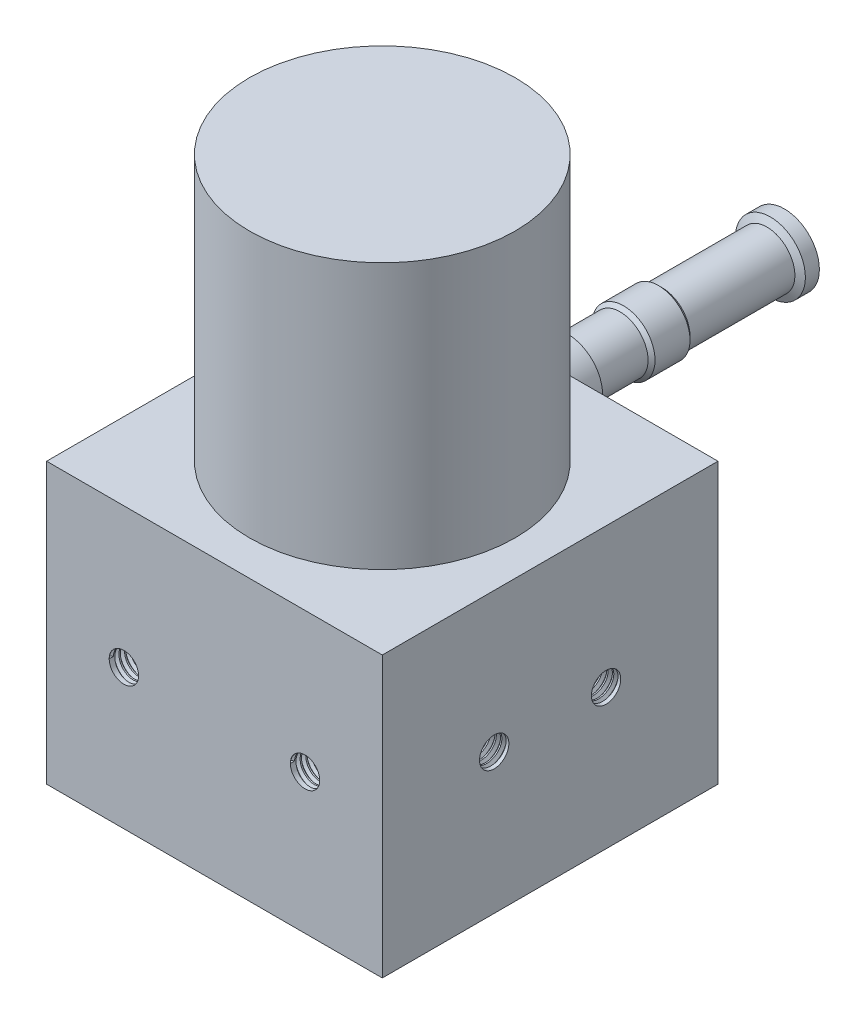
from build123d import *
from build123d.topology import SkipClean

# Parameters (mm, degrees)
SKETCH1_W           = 48
SKETCH1_H           = 48
BOSS_EXTRUDE1_DEPTH = 40
SKETCH2_R           = 19
BOSS_EXTRUDE2_DEPTH = 38
SKETCH4_R           = 5
BOSS_EXTRUDE3_DEPTH = 46
SKETCH5_W           = 31
SKETCH5_H           = 2
SKETCH6_R           = 2.1
CUT_EXTRUDE1_DEPTH  = 5
SKETCH8_R           = 2.1
CUT_EXTRUDE2_DEPTH  = 5
THREAD1_PITCH       = 0.8
THREAD2_PITCH       = 0.8
THREAD3_PITCH       = 0.8
THREAD4_PITCH       = 0.8


with BuildPart() as part:
    # Sketch1 → Boss-Extrude1 (new body)
    with BuildSketch(Plane(origin=(0, 0, 0), x_dir=(1, 0, 0), z_dir=(0, 1, 0))):
        Rectangle(SKETCH1_W, SKETCH1_H)
    extrude(amount=BOSS_EXTRUDE1_DEPTH)

    # Sketch2 → Boss-Extrude2 (add)
    with BuildSketch(Plane(origin=(0, 40, 0), x_dir=(1, 0, 0), z_dir=(0, 1, 0))):
        with Locations(Location((0, 0, 0), (0, 0, 270))):
            Circle(SKETCH2_R)
    extrude(amount=BOSS_EXTRUDE2_DEPTH)

    # Sketch4 → Boss-Extrude3 (add)
    with BuildSketch(Plane(origin=(0, 0, -24), x_dir=(-1, 0, 0), z_dir=(0, 0, -1))):
        with Locations(Location((12.5, 25, 0), (0, 0, 180))):
            Circle(SKETCH4_R)
    extrude(amount=BOSS_EXTRUDE3_DEPTH)

    # Sketch5 → Cut-Revolve1 (revolve, cut)
    with BuildSketch(Plane(origin=(-12.5, 0, 0), x_dir=(0, 0, -1), z_dir=(1, 0, 0)), mode=Mode.PRIVATE) as cut_revolve1_sk:
        Polygon((39, 30), (39, 29), (46.5, 29), (47, 29.5), (52, 29.5), (52.5, 29), (67.5, 29), (68, 30), align=None)
        with Locations((54.5, 26)):
            Rectangle(SKETCH5_W, SKETCH5_H)
    revolve(cut_revolve1_sk.sketch.rotate(Axis((-12.5, 25, -24), (0, 0, -1)), 90), axis=Axis((-12.5, 25, -24), (0, 0, -1)), mode=Mode.SUBTRACT)

    # Sketch6 → Cut-Extrude1 (cut)
    with BuildSketch(Plane.XY.offset(24)):
        with Locations((-12.954, 20)):
            Circle(SKETCH6_R)
        with Locations((12.954, 20)):
            Circle(SKETCH6_R)
    extrude(amount=-CUT_EXTRUDE1_DEPTH, mode=Mode.SUBTRACT)

    # Sketch8 → Cut-Extrude2 (cut)
    with BuildSketch(Plane(origin=(24, 0, 0), x_dir=(0, 0, -1), z_dir=(1, 0, 0))):
        with Locations((8, 20)):
            Circle(SKETCH8_R)
        with Locations((-8, 20)):
            Circle(SKETCH8_R)
    extrude(amount=-CUT_EXTRUDE2_DEPTH, mode=Mode.SUBTRACT)

    # Thread1: the profile of Thread Profile1 profile screwed along a right-hand helix of 6.25 turns, 8 arcs to a turn; built about Z, then put on its axis
    with SkipClean():  # the faces are left unmerged after this step: merging them gives an invalid solid
        thread1_z = Axis((0, 0, 0), (0, 0, 1))
        thread1_corners = [(2.0997, 0, -0.000173205), (2.5330127, 0, 0.249999999), (2.5330127, 0, 0.349999999), (2.0997, 0, 0.600173203)]
        with BuildLine(mode=Mode.PRIVATE) as thread1_profile:
            Line(thread1_corners[0], thread1_corners[1])
            Line(thread1_corners[1], thread1_corners[2])
            Line(thread1_corners[2], thread1_corners[3])
            Line(thread1_corners[3], thread1_corners[0])
        thread1_cap = Face(thread1_profile.wire())
        thread1_turn_angles = [0, 22.5, 45, 67.5, 90, 112.5, 135, 157.5, 180, 202.5, 225, 247.5, 270, 292.5, 315, 337.5, 360]
        thread1_turn_weights = [1, 0.9238795325112867, 1, 0.9238795325112867, 1, 0.9238795325112867, 1, 0.9238795325112867, 1, 0.9238795325112867, 1, 0.9238795325112867, 1, 0.9238795325112867, 1, 0.9238795325112867, 1]
        thread1_turn_rails = [Edge.make_bspline([Vector(p[0], p[1], 0).rotate(thread1_z, thread1_turn_angles[k]) / thread1_turn_weights[k] + Vector(0, 0, p[2] + THREAD1_PITCH * thread1_turn_angles[k] / 360) for k in range(17)], [0, 0, 0, 1, 1, 2, 2, 3, 3, 4, 4, 5, 5, 6, 6, 7, 7, 8, 8, 8], 2, thread1_turn_weights) for p in thread1_corners]
        thread1_turn_sides = [Face.make_surface_from_curves(thread1_turn_rails[p[0]], thread1_turn_rails[p[1]]) for p in [(0, 1), (1, 2), (2, 3), (3, 0)]]
        thread1_last_angles = [2160, 2182.5, 2205, 2227.5, 2250]
        thread1_last_weights = [1, 0.9238795325112867, 1, 0.9238795325112867, 1]
        thread1_last_rails = [Edge.make_bspline([Vector(p[0], p[1], 0).rotate(thread1_z, thread1_last_angles[k]) / thread1_last_weights[k] + Vector(0, 0, p[2] + THREAD1_PITCH * thread1_last_angles[k] / 360) for k in range(5)], [0, 0, 0, 1, 1, 2, 2, 2], 2, thread1_last_weights) for p in thread1_corners]
        thread1_last_sides = [Face.make_surface_from_curves(thread1_last_rails[p[0]], thread1_last_rails[p[1]]) for p in [(0, 1), (1, 2), (2, 3), (3, 0)]]
        thread1 = Plane(origin=(24, 20, 8), x_dir=(0, 0, 1), z_dir=(-1, 0, 0)) * Solid(Shell([*[p.moved(Location((0, 0, THREAD1_PITCH * i))) for i in range(6) for p in thread1_turn_sides], *thread1_last_sides, thread1_cap, thread1_cap.rotate(thread1_z, 2250).moved(Location((0, 0, THREAD1_PITCH * 2250 / 360)))]))
        add(thread1, mode=Mode.SUBTRACT)

    # Thread2: the profile of Thread Profile2 profile screwed along a right-hand helix of 6.25 turns, 8 arcs to a turn; built about Z, then put on its axis
    with SkipClean():  # the faces are left unmerged after this step: merging them gives an invalid solid
        thread2_z = Axis((0, 0, 0), (0, 0, 1))
        thread2_corners = [(2.0997, 0, -0.000173205), (2.5330127, 0, 0.249999999), (2.5330127, 0, 0.349999999), (2.0997, 0, 0.600173203)]
        with BuildLine(mode=Mode.PRIVATE) as thread2_profile:
            Line(thread2_corners[0], thread2_corners[1])
            Line(thread2_corners[1], thread2_corners[2])
            Line(thread2_corners[2], thread2_corners[3])
            Line(thread2_corners[3], thread2_corners[0])
        thread2_cap = Face(thread2_profile.wire())
        thread2_turn_angles = [0, 22.5, 45, 67.5, 90, 112.5, 135, 157.5, 180, 202.5, 225, 247.5, 270, 292.5, 315, 337.5, 360]
        thread2_turn_weights = [1, 0.9238795325112867, 1, 0.9238795325112867, 1, 0.9238795325112867, 1, 0.9238795325112867, 1, 0.9238795325112867, 1, 0.9238795325112867, 1, 0.9238795325112867, 1, 0.9238795325112867, 1]
        thread2_turn_rails = [Edge.make_bspline([Vector(p[0], p[1], 0).rotate(thread2_z, thread2_turn_angles[k]) / thread2_turn_weights[k] + Vector(0, 0, p[2] + THREAD2_PITCH * thread2_turn_angles[k] / 360) for k in range(17)], [0, 0, 0, 1, 1, 2, 2, 3, 3, 4, 4, 5, 5, 6, 6, 7, 7, 8, 8, 8], 2, thread2_turn_weights) for p in thread2_corners]
        thread2_turn_sides = [Face.make_surface_from_curves(thread2_turn_rails[p[0]], thread2_turn_rails[p[1]]) for p in [(0, 1), (1, 2), (2, 3), (3, 0)]]
        thread2_last_angles = [2160, 2182.5, 2205, 2227.5, 2250]
        thread2_last_weights = [1, 0.9238795325112867, 1, 0.9238795325112867, 1]
        thread2_last_rails = [Edge.make_bspline([Vector(p[0], p[1], 0).rotate(thread2_z, thread2_last_angles[k]) / thread2_last_weights[k] + Vector(0, 0, p[2] + THREAD2_PITCH * thread2_last_angles[k] / 360) for k in range(5)], [0, 0, 0, 1, 1, 2, 2, 2], 2, thread2_last_weights) for p in thread2_corners]
        thread2_last_sides = [Face.make_surface_from_curves(thread2_last_rails[p[0]], thread2_last_rails[p[1]]) for p in [(0, 1), (1, 2), (2, 3), (3, 0)]]
        thread2 = Plane(origin=(24, 20, -8), x_dir=(0, 0, 1), z_dir=(-1, 0, 0)) * Solid(Shell([*[p.moved(Location((0, 0, THREAD2_PITCH * i))) for i in range(6) for p in thread2_turn_sides], *thread2_last_sides, thread2_cap, thread2_cap.rotate(thread2_z, 2250).moved(Location((0, 0, THREAD2_PITCH * 2250 / 360)))]))
        add(thread2, mode=Mode.SUBTRACT)

    # Thread3: the profile of Thread Profile3 profile screwed along a right-hand helix of 6.25 turns, 8 arcs to a turn; built about Z, then put on its axis
    with SkipClean():  # the faces are left unmerged after this step: merging them gives an invalid solid
        thread3_z = Axis((0, 0, 0), (0, 0, 1))
        thread3_corners = [(2.0997, 0, -0.000173205), (2.5330127, 0, 0.249999999), (2.5330127, 0, 0.349999999), (2.0997, 0, 0.600173203)]
        with BuildLine(mode=Mode.PRIVATE) as thread3_profile:
            Line(thread3_corners[0], thread3_corners[1])
            Line(thread3_corners[1], thread3_corners[2])
            Line(thread3_corners[2], thread3_corners[3])
            Line(thread3_corners[3], thread3_corners[0])
        thread3_cap = Face(thread3_profile.wire())
        thread3_turn_angles = [0, 22.5, 45, 67.5, 90, 112.5, 135, 157.5, 180, 202.5, 225, 247.5, 270, 292.5, 315, 337.5, 360]
        thread3_turn_weights = [1, 0.9238795325112867, 1, 0.9238795325112867, 1, 0.9238795325112867, 1, 0.9238795325112867, 1, 0.9238795325112867, 1, 0.9238795325112867, 1, 0.9238795325112867, 1, 0.9238795325112867, 1]
        thread3_turn_rails = [Edge.make_bspline([Vector(p[0], p[1], 0).rotate(thread3_z, thread3_turn_angles[k]) / thread3_turn_weights[k] + Vector(0, 0, p[2] + THREAD3_PITCH * thread3_turn_angles[k] / 360) for k in range(17)], [0, 0, 0, 1, 1, 2, 2, 3, 3, 4, 4, 5, 5, 6, 6, 7, 7, 8, 8, 8], 2, thread3_turn_weights) for p in thread3_corners]
        thread3_turn_sides = [Face.make_surface_from_curves(thread3_turn_rails[p[0]], thread3_turn_rails[p[1]]) for p in [(0, 1), (1, 2), (2, 3), (3, 0)]]
        thread3_last_angles = [2160, 2182.5, 2205, 2227.5, 2250]
        thread3_last_weights = [1, 0.9238795325112867, 1, 0.9238795325112867, 1]
        thread3_last_rails = [Edge.make_bspline([Vector(p[0], p[1], 0).rotate(thread3_z, thread3_last_angles[k]) / thread3_last_weights[k] + Vector(0, 0, p[2] + THREAD3_PITCH * thread3_last_angles[k] / 360) for k in range(5)], [0, 0, 0, 1, 1, 2, 2, 2], 2, thread3_last_weights) for p in thread3_corners]
        thread3_last_sides = [Face.make_surface_from_curves(thread3_last_rails[p[0]], thread3_last_rails[p[1]]) for p in [(0, 1), (1, 2), (2, 3), (3, 0)]]
        thread3 = Plane(origin=(12.954, 20, 24), x_dir=(-1, 0, 0), z_dir=(0, 0, -1)) * Solid(Shell([*[p.moved(Location((0, 0, THREAD3_PITCH * i))) for i in range(6) for p in thread3_turn_sides], *thread3_last_sides, thread3_cap, thread3_cap.rotate(thread3_z, 2250).moved(Location((0, 0, THREAD3_PITCH * 2250 / 360)))]))
        add(thread3, mode=Mode.SUBTRACT)

    # Thread4: the profile of Thread Profile4 profile screwed along a right-hand helix of 6.25 turns, 8 arcs to a turn; built about Z, then put on its axis
    with SkipClean():  # the faces are left unmerged after this step: merging them gives an invalid solid
        thread4_z = Axis((0, 0, 0), (0, 0, 1))
        thread4_corners = [(2.0997, 0, -0.000173205), (2.5330127, 0, 0.249999999), (2.5330127, 0, 0.349999999), (2.0997, 0, 0.600173203)]
        with BuildLine(mode=Mode.PRIVATE) as thread4_profile:
            Line(thread4_corners[0], thread4_corners[1])
            Line(thread4_corners[1], thread4_corners[2])
            Line(thread4_corners[2], thread4_corners[3])
            Line(thread4_corners[3], thread4_corners[0])
        thread4_cap = Face(thread4_profile.wire())
        thread4_turn_angles = [0, 22.5, 45, 67.5, 90, 112.5, 135, 157.5, 180, 202.5, 225, 247.5, 270, 292.5, 315, 337.5, 360]
        thread4_turn_weights = [1, 0.9238795325112867, 1, 0.9238795325112867, 1, 0.9238795325112867, 1, 0.9238795325112867, 1, 0.9238795325112867, 1, 0.9238795325112867, 1, 0.9238795325112867, 1, 0.9238795325112867, 1]
        thread4_turn_rails = [Edge.make_bspline([Vector(p[0], p[1], 0).rotate(thread4_z, thread4_turn_angles[k]) / thread4_turn_weights[k] + Vector(0, 0, p[2] + THREAD4_PITCH * thread4_turn_angles[k] / 360) for k in range(17)], [0, 0, 0, 1, 1, 2, 2, 3, 3, 4, 4, 5, 5, 6, 6, 7, 7, 8, 8, 8], 2, thread4_turn_weights) for p in thread4_corners]
        thread4_turn_sides = [Face.make_surface_from_curves(thread4_turn_rails[p[0]], thread4_turn_rails[p[1]]) for p in [(0, 1), (1, 2), (2, 3), (3, 0)]]
        thread4_last_angles = [2160, 2182.5, 2205, 2227.5, 2250]
        thread4_last_weights = [1, 0.9238795325112867, 1, 0.9238795325112867, 1]
        thread4_last_rails = [Edge.make_bspline([Vector(p[0], p[1], 0).rotate(thread4_z, thread4_last_angles[k]) / thread4_last_weights[k] + Vector(0, 0, p[2] + THREAD4_PITCH * thread4_last_angles[k] / 360) for k in range(5)], [0, 0, 0, 1, 1, 2, 2, 2], 2, thread4_last_weights) for p in thread4_corners]
        thread4_last_sides = [Face.make_surface_from_curves(thread4_last_rails[p[0]], thread4_last_rails[p[1]]) for p in [(0, 1), (1, 2), (2, 3), (3, 0)]]
        thread4 = Plane(origin=(-12.954, 20, 24), x_dir=(-1, 0, 0), z_dir=(0, 0, -1)) * Solid(Shell([*[p.moved(Location((0, 0, THREAD4_PITCH * i))) for i in range(6) for p in thread4_turn_sides], *thread4_last_sides, thread4_cap, thread4_cap.rotate(thread4_z, 2250).moved(Location((0, 0, THREAD4_PITCH * 2250 / 360)))]))
        add(thread4, mode=Mode.SUBTRACT)


solid = part.part
